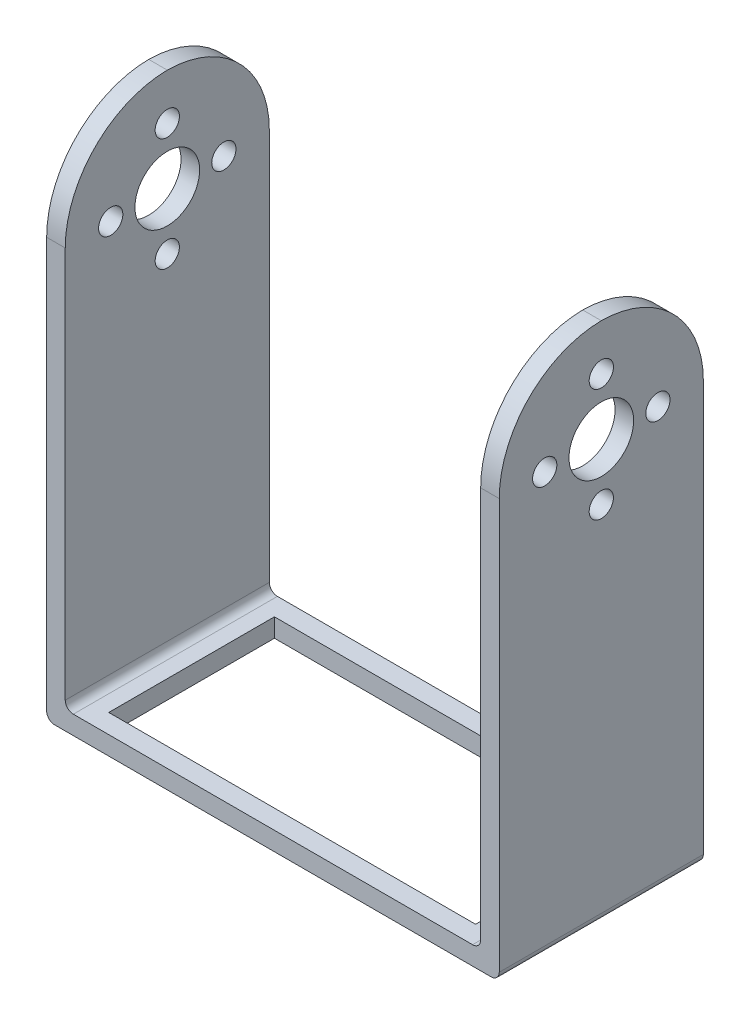
from build123d import *

# Parameters (mm, degrees)
SKETCH1_W           = 56
SKETCH1_H           = 64.5
BOSS_EXTRUDE1_DEPTH = 25.25
SKETCH2_W           = 51.4
SKETCH2_H           = 62.2
CUT_EXTRUDE1_DEPTH  = 50.614765947
FILLET1_R           = 1
FILLET3_R           = 12.75
SKETCH4_W           = 45.38697638
SKETCH4_H           = 20.5
CUT_EXTRUDE3_DEPTH  = 75.710999554
SKETCH5_R           = 4
SKETCH5_R_2         = 1.5
CUT_EXTRUDE4_DEPTH  = 70.380292591


with BuildPart() as part:
    # Sketch1 → Boss-Extrude1 (new body)
    with BuildSketch(Plane.XY):
        Rectangle(SKETCH1_W, SKETCH1_H)
    extrude(amount=BOSS_EXTRUDE1_DEPTH)

    # Sketch2 → Cut-Extrude1 (cut, through all)
    with BuildSketch(Plane.XY.offset(25.25)):
        with Locations((0, 1.15)):
            Rectangle(SKETCH2_W, SKETCH2_H)
    extrude(amount=-CUT_EXTRUDE1_DEPTH, mode=Mode.SUBTRACT)

    # Fillet1
    fillet1_edges = [part.edges().sort_by_distance(p)[0] for p in [
        (-25.7, -29.95, 12.625),
        (25.7, -29.95, 12.625),
        (28, -32.25, 12.625),
        (-28, -32.25, 12.625),
    ]]
    fillet(fillet1_edges, radius=FILLET1_R)

    # Fillet3
    # the kernel refuses this fillet: 12.75 mm, written as the material it takes off along each edge
    with BuildSketch(Plane(origin=(-59.875, 32.25, 25.25), x_dir=(0, 0, -1), z_dir=(1, 0, 0)), Plane(origin=(-6.175, 32.25, 25.25), x_dir=(0, 0, -1), z_dir=(1, 0, 0)), Plane(origin=(-59.875, 32.25, 0), x_dir=(0, -1, 0), z_dir=(1, 0, 0)), Plane(origin=(-6.175, 32.25, 0), x_dir=(0, -1, 0), z_dir=(1, 0, 0))) as fillet3_piece_1:
        with BuildLine():
            CenterArc((FILLET3_R, -FILLET3_R), FILLET3_R, 90, 90)
            Line((0, -FILLET3_R), (0, 0))
            Line((0, 0), (FILLET3_R, 0))
        make_face()
    extrude(amount=66.05, mode=Mode.SUBTRACT)

    # Sketch4 → Cut-Extrude3 (cut, through all)
    with BuildSketch(Plane.XZ.offset(32.25)):
        with Locations((0, 12.625)):
            Rectangle(SKETCH4_W, SKETCH4_H)
    extrude(amount=-CUT_EXTRUDE3_DEPTH, mode=Mode.SUBTRACT)

    # Sketch5 → Cut-Extrude4 (cut, through all)
    with BuildSketch(Plane.ZY.offset(28)):
        with Locations(Location((12.625, 19.54938724, 0), (0, 0, 270))):
            Circle(SKETCH5_R)
        with Locations(Location((12.625, 26.54938724, 0), (0, 0, 270))):
            Circle(SKETCH5_R_2)
        with Locations(Location((19.625, 19.54938724, 0), (0, 0, 270))):
            Circle(SKETCH5_R_2)
        with Locations(Location((12.625, 12.54938724, 0), (0, 0, 270))):
            Circle(SKETCH5_R_2)
        with Locations(Location((5.625, 19.54938724, 0), (0, 0, 270))):
            Circle(SKETCH5_R_2)
    extrude(amount=-CUT_EXTRUDE4_DEPTH, mode=Mode.SUBTRACT)


solid = part.part
